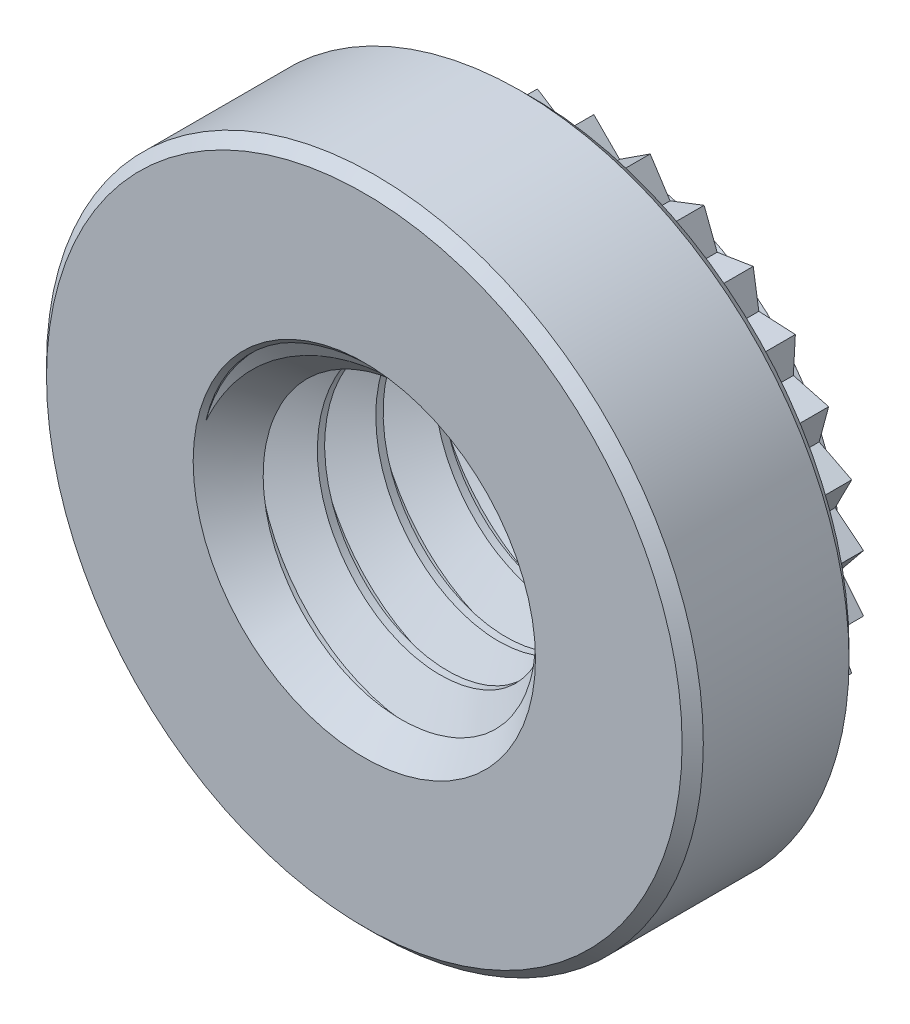
from build123d import *

# Parameters (mm, degrees)
SKETCH1_R           = 3.935
EXTRUDE1_DEPTH      = 2
SKETCH2_R           = 2.7125
EXTRUDE2_DEPTH      = 1
SKETCH5_OUTSIDE_W   = 12.358
SKETCH5_OUTSIDE_H   = 12.358
SKETCH5_OUTSIDE_R   = 2.69
CUT_EXTRUDE1_DEPTH  = 0.25
CUT_EXTRUDE1_DRAFT  = 20
CHAMFER2_SIZE       = 0.127
SKETCH7_R           = 2
CUT_EXTRUDE3_DEPTH  = 7.322060582
SWEEP1_PITCH        = 0.7
SKETCH10_R          = 3.935
CUT_EXTRUDE4_DEPTH  = 7.634746296
SKETCH11_R          = 2.69
CUT_EXTRUDE5_DEPTH  = 7.322060629
BOSS_EXTRUDE1_START = -0.75
BOSS_EXTRUDE1_DEPTH = 0.75
CIRPATTERN4_COUNT   = 30


with BuildPart() as part:
    # Sketch1 → Extrude1 (new body)
    with BuildSketch(Plane.XY):
        Circle(SKETCH1_R)
    extrude(amount=-EXTRUDE1_DEPTH)

    # Sketch2 → Extrude2 (add)
    with BuildSketch(Plane(origin=(0, 0, -2), x_dir=(-1, 0, 0), z_dir=(0, 0, -1))):
        with Locations(Location((0, 0, 0), (0, 0, 180))):
            Circle(SKETCH2_R)
    extrude(amount=EXTRUDE2_DEPTH)


with BuildPart() as cut_extrude1_tool:
    # Sketch5 outside → Cut-Extrude1 (with draft: the straight prism first)
    with BuildSketch(Plane(origin=(0, 0, -3), x_dir=(-1, 0, 0), z_dir=(0, 0, -1))):
        Rectangle(SKETCH5_OUTSIDE_W, SKETCH5_OUTSIDE_H)
        Circle(SKETCH5_OUTSIDE_R, mode=Mode.SUBTRACT)
    extrude(amount=-CUT_EXTRUDE1_DEPTH)
    # Cut-Extrude1: the draft: its side faces are tilted about the plane it starts from
    cut_extrude1_sides = [cut_extrude1_tool.faces().sort_by_distance(p)[0] for p in [
        (0, -6.179, -2.875),
        (-6.179, 0, -2.875),
        (0, 6.179, -2.875),
        (6.179, 0, -2.875),
        (2.69, 0, -2.875),
    ]]
    draft(cut_extrude1_sides, Plane(origin=(0, 0, -3), x_dir=(-1, 0, 0), z_dir=(0, 0, -1)), CUT_EXTRUDE1_DRAFT)


with BuildPart() as part_1:
    add(part.part)

    # Cut-Extrude1: cut by cut_extrude1_tool
    add(cut_extrude1_tool.part, mode=Mode.SUBTRACT)

    # Chamfer2
    chamfer2_edges = [part_1.edges().sort_by_distance(p)[0] for p in [
        (-3.935, 0, 0),
        (-3.935, 0, -2),
    ]]
    chamfer(chamfer2_edges, length=CHAMFER2_SIZE)

    # Sketch7 → Cut-Extrude3 (cut, through all)
    with BuildSketch(Plane.XY):
        Circle(SKETCH7_R)
    extrude(amount=-CUT_EXTRUDE3_DEPTH, mode=Mode.SUBTRACT)

    # Sweep1: the profile of Sketch9 profile screwed along a right-hand helix of 7.142857 turns, 6 arcs to a turn; built about Z, then put on its axis
    sweep1_z = Axis((0, 0, 0), (0, 0, 1))
    sweep1_corners = [(2.0003, 0, -0.612673205), (1.545336663, 0, -0.35), (1.545336663, 0, -0.2625), (2.0003, 0, 0.000173205)]
    with BuildLine(mode=Mode.PRIVATE) as sweep1_profile:
        Line(sweep1_corners[0], sweep1_corners[1])
        Line(sweep1_corners[1], sweep1_corners[2])
        Line(sweep1_corners[2], sweep1_corners[3])
        Line(sweep1_corners[3], sweep1_corners[0])
    sweep1_cap = Face(sweep1_profile.wire())
    sweep1_turn_angles = [0, 30, 60, 90, 120, 150, 180, 210, 240, 270, 300, 330, 360]
    sweep1_turn_weights = [1, 0.8660254037844387, 1, 0.8660254037844387, 1, 0.8660254037844387, 1, 0.8660254037844387, 1, 0.8660254037844387, 1, 0.8660254037844387, 1]
    sweep1_turn_rails = [Edge.make_bspline([Vector(p[0], p[1], 0).rotate(sweep1_z, sweep1_turn_angles[k]) / sweep1_turn_weights[k] + Vector(0, 0, p[2] + SWEEP1_PITCH * sweep1_turn_angles[k] / 360) for k in range(13)], [0, 0, 0, 1, 1, 2, 2, 3, 3, 4, 4, 5, 5, 6, 6, 6], 2, sweep1_turn_weights) for p in sweep1_corners]
    sweep1_turn_sides = [Face.make_surface_from_curves(sweep1_turn_rails[p[0]], sweep1_turn_rails[p[1]]) for p in [(0, 1), (1, 2), (2, 3), (3, 0)]]
    sweep1_last_angles = [2520, 2545.714285714, 2571.428571429]
    sweep1_last_weights = [1, 0.9009688679024169, 1]
    sweep1_last_rails = [Edge.make_bspline([Vector(p[0], p[1], 0).rotate(sweep1_z, sweep1_last_angles[k]) / sweep1_last_weights[k] + Vector(0, 0, p[2] + SWEEP1_PITCH * sweep1_last_angles[k] / 360) for k in range(3)], [0, 0, 0, 1, 1, 1], 2, sweep1_last_weights) for p in sweep1_corners]
    sweep1_last_sides = [Face.make_surface_from_curves(sweep1_last_rails[p[0]], sweep1_last_rails[p[1]]) for p in [(0, 1), (1, 2), (2, 3), (3, 0)]]
    sweep1 = Plane(origin=(0, 0, -3), x_dir=(0, 1, 0), z_dir=(0, 0, 1)) * Solid(Shell([*[p.moved(Location((0, 0, SWEEP1_PITCH * i))) for i in range(7) for p in sweep1_turn_sides], *sweep1_last_sides, sweep1_cap, sweep1_cap.rotate(sweep1_z, 2571.428571429).moved(Location((0, 0, SWEEP1_PITCH * 2571.428571429 / 360)))]))
    add(sweep1)

    # Sketch10 → Cut-Extrude4 (cut, through all)
    with BuildSketch(Plane.XY):
        Circle(SKETCH10_R)
    extrude(amount=CUT_EXTRUDE4_DEPTH, mode=Mode.SUBTRACT)

    # Sketch11 → Cut-Extrude5 (cut, through all)
    with BuildSketch(Plane(origin=(0, 0, -3), x_dir=(-1, 0, 0), z_dir=(0, 0, -1))):
        Circle(SKETCH11_R)
    extrude(amount=CUT_EXTRUDE5_DEPTH, mode=Mode.SUBTRACT)

    # Cut-Extrude6 cone 1 section (through the dimple's axis) → Cut-Extrude6 (revolve, cut)
    with BuildSketch(Plane(origin=(0, 0, 0), x_dir=(0, -1, 0), z_dir=(1, 0, 0))):
        Polygon((0, 0), (2.0508, 0), (0, 2.0508), align=None)
    revolve(axis=Axis((0, 0, 0), (0, 0, -1)), mode=Mode.SUBTRACT)

    # Cut-Extrude7 cone 1 section (through the dimple's axis) → Cut-Extrude7 (revolve, cut)
    with BuildSketch(Plane(origin=(0, 0, -3), x_dir=(0, 1, 0), z_dir=(1, 0, 0))):
        Polygon((0, 0), (2.0635, 0), (0, 2.0635), align=None)
    revolve(axis=Axis((0, 0, -3), (0, 0, 1)), mode=Mode.SUBTRACT)

    # Sketch16 → Boss-Extrude1 (add)
    with BuildSketch(Plane(origin=(0, 0, -2.75), x_dir=(-1, 0, 0), z_dir=(0, 0, -1)).offset(BOSS_EXTRUDE1_START)):
        with BuildLine():
            Line((0, 3.249), (-0.602777778, 2.644676767))
            ThreePointArc((-0.602777778, 2.644676767), (0, 2.7125), (0.602777778, 2.644676767))
            Line((0.602777778, 2.644676767), (0, 3.249))
        make_face()
    boss_extrude1 = extrude(amount=BOSS_EXTRUDE1_DEPTH)

    # CirPattern4: Boss-Extrude1 ×30 about axis
    cirpattern4_axis = Axis((0, 0, 0), (0, 0, 1))
    for i in range(1, CIRPATTERN4_COUNT):
        add(boss_extrude1.rotate(cirpattern4_axis, i * 360 / CIRPATTERN4_COUNT))


solid = part_1.part
